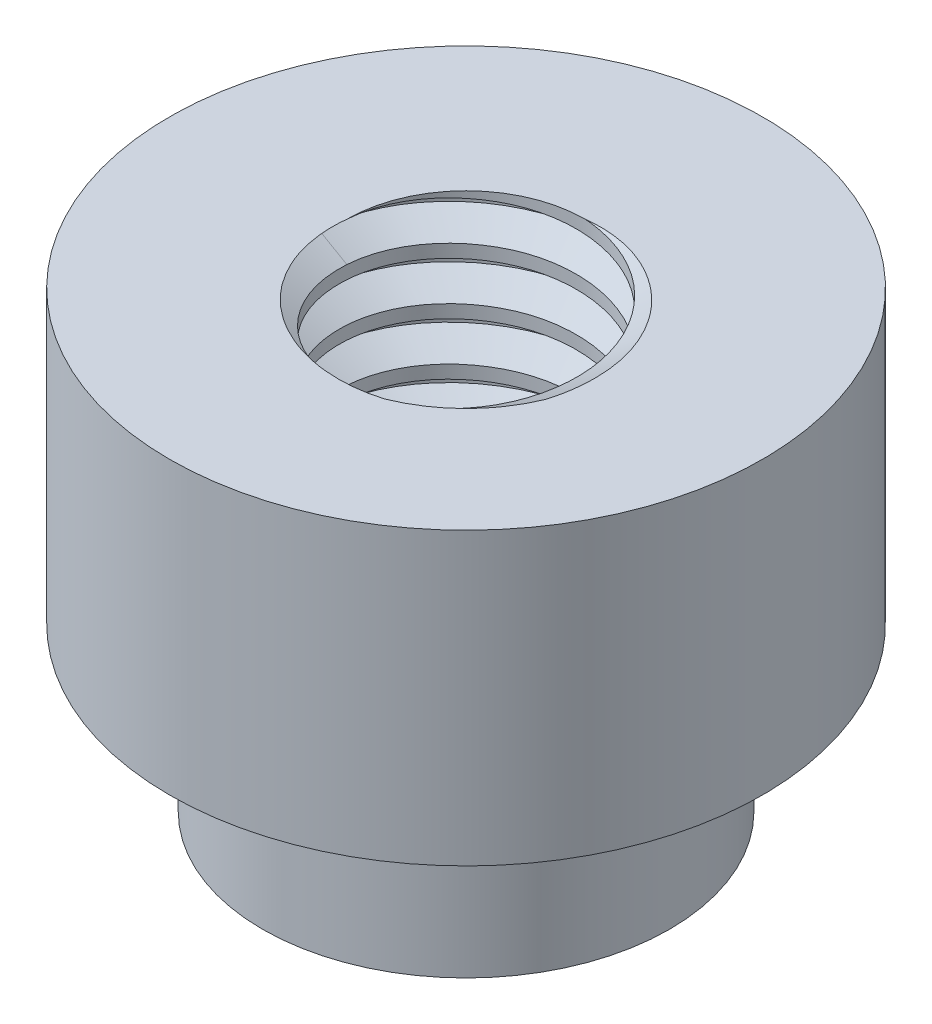
from build123d import *

# Parameters (mm, degrees)
SKETCH1_R                      = 1.75
BOSS_EXTRUDE1_DEPTH            = 1.4
SKETCH2_R                      = 2.55
BOSS_EXTRUDE2_DEPTH            = 2.5
TAP_DRILL_FOR_M2_5X0_45_TAP1_D = 2.05
THREAD1_PITCH                  = 0.45
THREAD2_PITCH                  = 0.45


with BuildPart() as part:
    # Sketch1 → Boss-Extrude1 (new body)
    with BuildSketch(Plane(origin=(0, 0, 0), x_dir=(1, 0, 0), z_dir=(0, 1, 0))):
        with Locations(Location((0, 0, 0), (0, 0, 270))):
            Circle(SKETCH1_R)
    extrude(amount=BOSS_EXTRUDE1_DEPTH)

    # Sketch2 → Boss-Extrude2 (add)
    with BuildSketch(Plane(origin=(0, 1.4, 0), x_dir=(1, 0, 0), z_dir=(0, 1, 0))):
        with Locations(Location((0, 0, 0), (0, 0, 270))):
            Circle(SKETCH2_R)
    extrude(amount=BOSS_EXTRUDE2_DEPTH)

    # Tap Drill for M2.5x0.45 Tap1 (through all)
    with Locations(Plane(origin=(0, 3.9, 0), x_dir=(1, 0, 0), z_dir=(0, 1, 0))):
        with Locations((0, 0)):
            Hole(TAP_DRILL_FOR_M2_5X0_45_TAP1_D / 2)

    # Thread1: arcs per turn and ends read off the stored shape
    # Thread1: the profile of Thread Profile1 profile screwed along a right-hand helix through 10 turns, 6 arcs to a turn; built about Z, then put on its axis
    thread1_z = Axis((0, 0, 0), (0, 0, 1))
    thread1_corners = [(1.0247, 0, -0.000173205), (1.268569644, 0, 0.140624999), (1.268569644, 0, 0.196874999), (1.0247, 0, 0.337673204)]
    with BuildLine(mode=Mode.PRIVATE) as thread1_profile:
        Line(thread1_corners[0], thread1_corners[1])
        Line(thread1_corners[1], thread1_corners[2])
        Line(thread1_corners[2], thread1_corners[3])
        Line(thread1_corners[3], thread1_corners[0])
    thread1_cap = Face(thread1_profile.wire())
    thread1_turn_angles = [0, 30, 60, 90, 120, 150, 180, 210, 240, 270, 300, 330, 360]
    thread1_turn_weights = [1, 0.8660254037844387, 1, 0.8660254037844387, 1, 0.8660254037844387, 1, 0.8660254037844387, 1, 0.8660254037844387, 1, 0.8660254037844387, 1]
    thread1_turn_rails = [Edge.make_bspline([Vector(p[0], p[1], 0).rotate(thread1_z, thread1_turn_angles[k]) / thread1_turn_weights[k] + Vector(0, 0, p[2] + THREAD1_PITCH * thread1_turn_angles[k] / 360) for k in range(13)], [0, 0, 0, 1, 1, 2, 2, 3, 3, 4, 4, 5, 5, 6, 6, 6], 2, thread1_turn_weights) for p in thread1_corners]
    thread1_turn_sides = [Face.make_surface_from_curves(thread1_turn_rails[p[0]], thread1_turn_rails[p[1]]) for p in [(0, 1), (1, 2), (2, 3), (3, 0)]]
    thread1 = Plane(origin=(0, 3.9, 0), x_dir=(-1, 0, 0), z_dir=(0, -1, 0)) * Solid(Shell([*[p.moved(Location((0, 0, THREAD1_PITCH * i))) for i in range(10) for p in thread1_turn_sides], thread1_cap, thread1_cap.rotate(thread1_z, 3600).moved(Location((0, 0, THREAD1_PITCH * 3600 / 360)))]))
    add(thread1, mode=Mode.SUBTRACT)

    # Thread2: arcs per turn and ends read off the stored shape
    # Thread2: the profile of Thread Profile2 profile screwed along a right-hand helix through 10 turns, 6 arcs to a turn; built about Z, then put on its axis
    thread2_z = Axis((0, 0, 0), (0, 0, 1))
    thread2_corners = [(1.0247, 0, -4.500173205), (1.268569644, 0, -4.359375001), (1.268569644, 0, -4.303125001), (1.0247, 0, -4.162326796)]
    with BuildLine(mode=Mode.PRIVATE) as thread2_profile:
        Line(thread2_corners[0], thread2_corners[1])
        Line(thread2_corners[1], thread2_corners[2])
        Line(thread2_corners[2], thread2_corners[3])
        Line(thread2_corners[3], thread2_corners[0])
    thread2_cap = Face(thread2_profile.wire())
    thread2_turn_angles = [0, 30, 60, 90, 120, 150, 180, 210, 240, 270, 300, 330, 360]
    thread2_turn_weights = [1, 0.8660254037844387, 1, 0.8660254037844387, 1, 0.8660254037844387, 1, 0.8660254037844387, 1, 0.8660254037844387, 1, 0.8660254037844387, 1]
    thread2_turn_rails = [Edge.make_bspline([Vector(p[0], p[1], 0).rotate(thread2_z, thread2_turn_angles[k]) / thread2_turn_weights[k] + Vector(0, 0, p[2] + THREAD2_PITCH * thread2_turn_angles[k] / 360) for k in range(13)], [0, 0, 0, 1, 1, 2, 2, 3, 3, 4, 4, 5, 5, 6, 6, 6], 2, thread2_turn_weights) for p in thread2_corners]
    thread2_turn_sides = [Face.make_surface_from_curves(thread2_turn_rails[p[0]], thread2_turn_rails[p[1]]) for p in [(0, 1), (1, 2), (2, 3), (3, 0)]]
    thread2 = Plane(origin=(0, 3.9, 0), x_dir=(-1, 0, 0), z_dir=(0, -1, 0)) * Solid(Shell([*[p.moved(Location((0, 0, THREAD2_PITCH * i))) for i in range(10) for p in thread2_turn_sides], thread2_cap, thread2_cap.rotate(thread2_z, 3600).moved(Location((0, 0, THREAD2_PITCH * 3600 / 360)))]))
    add(thread2, mode=Mode.SUBTRACT)


solid = part.part
